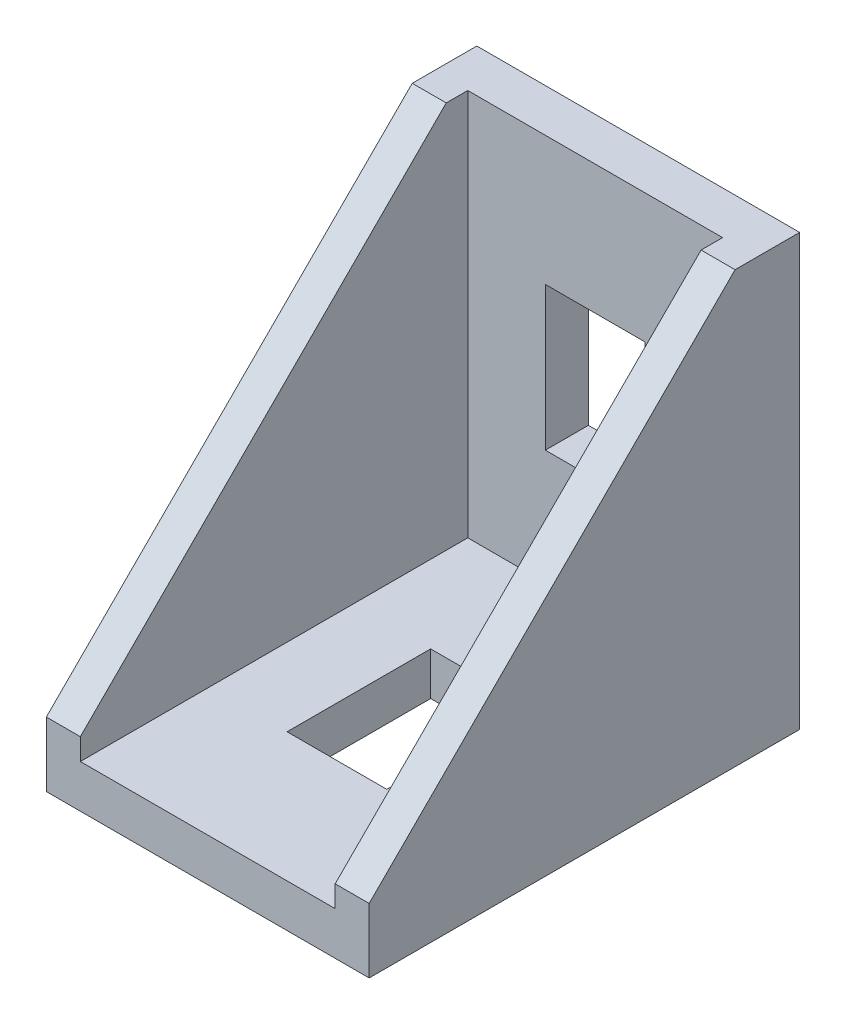
from build123d import *

# Parameters (mm, degrees)
BOSS_EXTRUDE2_DEPTH     = 7.5
CAVITY_START            = 2
SKETCH3_W               = 5.92
SKETCH3_H               = 9.5
CAVITY_DEPTH            = 23.259018941
SLOT_CUT_REACH          = 26.259
SQUARE_START            = -2
SKETCH8_W               = 2.315
SKETCH8_H               = 6.67
SQUARE_SLOT_DEPTH       = 2
BOSS_EXTRUDE3_DEPTH     = 0.8
SKETCH9_W               = 2.86
SKETCH9_H               = 1.08
SQUARE_RAILS_DEPTH      = 1.08
HALF_START              = 5.92
HALF_MIRROR_DEPTH       = 1.58
HALF_MIRROR_2_OUTLINE_W = 6
HALF_MIRROR_2_OUTLINE_H = 2
HALF_MIRROR_2_DEPTH     = 5.92
HALF_START_2            = 2.315
HALF_MIRROR_3_OUTLINE_W = 6.67
HALF_MIRROR_3_OUTLINE_H = 2
HALF_MIRROR_3_DEPTH     = 3.605
HALF_MIRROR_4_OUTLINE_W = 1.08
HALF_MIRROR_4_OUTLINE_H = 1.08
HALF_MIRROR_4_DEPTH     = 2.86
FULL_START              = -7.5
FULL_MIRROR_OUTLINE_W   = 2
FULL_MIRROR_OUTLINE_H   = 6
FULL_MIRROR_DEPTH       = 15
FULL_MIRROR_2_DEPTH     = 1.58
FULL_START_2            = 5.92
FULL_MIRROR_3_DEPTH     = 1.58
FULL_START_3            = -5.92
FULL_MIRROR_4_OUTLINE_W = 2
FULL_MIRROR_4_OUTLINE_H = 6.67
FULL_MIRROR_4_DEPTH     = 3.605
FULL_START_4            = 2.315
FULL_MIRROR_5_OUTLINE_W = 2
FULL_MIRROR_5_OUTLINE_H = 6.67
FULL_MIRROR_5_DEPTH     = 3.605
FULL_START_5            = -2.86
FULL_MIRROR_6_OUTLINE_W = 1.08
FULL_MIRROR_6_OUTLINE_H = 1.08
FULL_MIRROR_6_DEPTH     = 5.72


# Read off the part's stored shape, not the designer's step: Half mirror, Full mirror
with BuildPart() as part:
    # Sketch2 → Boss-Extrude2 (new body)
    with BuildSketch(Plane(origin=(0, 0, 0), x_dir=(0, 0, -1), z_dir=(1, 0, 0))):
        Polygon((-11.5, 11.5), (-3, 20), (0, 20), (0, 0), align=None)
    extrude(amount=-BOSS_EXTRUDE2_DEPTH)

    # Sketch3 → Cavity (cut, through all)
    with BuildSketch(Plane(origin=(0, 0, 0), x_dir=(1, 0, 0), z_dir=(0, 1, 0)).offset(CAVITY_START)):
        with Locations((-2.96, -6.75)):
            Rectangle(SKETCH3_W, SKETCH3_H)
    extrude(amount=CAVITY_DEPTH, mode=Mode.SUBTRACT)

    # Sketch4 → Slot cut (cut, up to next)
    with BuildSketch(Plane.XY, mode=Mode.PRIVATE) as slot_cut_sk1:
        with BuildLine():
            Line((0, 7.33), (-0.015, 7.33))
            ThreePointArc((-0.015, 7.33), (-1.641345597, 8.003654403), (-2.315, 9.63))
            Line((-2.315, 9.63), (-2.315, 11.7))
            ThreePointArc((-2.315, 11.7), (-1.641345597, 13.326345597), (-0.015, 14))
            Line((-0.015, 14), (0, 14))
            Line((0, 14), (0, 7.33))
        make_face()
    slot_cut_tool1 = extrude(slot_cut_sk1.sketch, amount=SLOT_CUT_REACH, mode=Mode.PRIVATE) & part.part
    add(slot_cut_tool1.solids().sort_by_distance((-1.046523, 10.665, 0))[0], mode=Mode.SUBTRACT)

    # Sketch8 → Square slot (cut)
    with BuildSketch(Plane(origin=(0, 0, 0), x_dir=(-1, 0, 0), z_dir=(0, 0, -1)).offset(SQUARE_START)):
        with Locations((1.1575, 10.665)):
            Rectangle(SKETCH8_W, SKETCH8_H)
    extrude(amount=SQUARE_SLOT_DEPTH, mode=Mode.SUBTRACT)

    # Sketch6 → Boss-Extrude3 (add)
    with BuildSketch(Plane(origin=(0, 0, 0), x_dir=(-1, 0, 0), z_dir=(0, 0, -1))):
        with BuildLine():
            Line((0, 3.18), (2.33, 3.18))
            ThreePointArc((2.33, 3.18), (2.704766594, 3.024766594), (2.86, 2.65))
            Line((2.86, 2.65), (2.86, 2.63))
            ThreePointArc((2.86, 2.63), (2.704766594, 2.255233406), (2.33, 2.1))
            Line((2.33, 2.1), (0, 2.1))
            Line((0, 2.1), (0, 3.18))
        make_face()
        with BuildLine():
            Line((0, 17.26), (2.33, 17.26))
            ThreePointArc((2.33, 17.26), (2.704766594, 17.104766594), (2.86, 16.73))
            Line((2.86, 16.73), (2.86, 16.71))
            ThreePointArc((2.86, 16.71), (2.704766594, 16.335233406), (2.33, 16.18))
            Line((2.33, 16.18), (0, 16.18))
            Line((0, 16.18), (0, 17.26))
        make_face()
    extrude(amount=BOSS_EXTRUDE3_DEPTH)

    # Sketch9 → Square rails (add)
    with BuildSketch(Plane(origin=(0, 0, 0), x_dir=(-1, 0, 0), z_dir=(0, 0, -1))):
        with Locations((1.43, 16.72)):
            Rectangle(SKETCH9_W, SKETCH9_H)
        with Locations((1.43, 2.64)):
            Rectangle(SKETCH9_W, SKETCH9_H)
    extrude(amount=SQUARE_RAILS_DEPTH)



with BuildPart() as body_2:
    # Half mirror outline → Half mirror (new body)
    with BuildSketch(Plane.YZ.offset(HALF_START)):
        Polygon((0, 0), (20, 0), (20, 3), (11.5, 11.5), align=None)
    extrude(amount=HALF_MIRROR_DEPTH)


with BuildPart() as part_1:
    add(part.part)

    add(body_2.part)  # Half mirror 2 merges body 2
    # Half mirror 2 outline → Half mirror 2 (add)
    with BuildSketch(Plane.YZ):
        Polygon((2, 2), (0, 0), (7.33, 0), (7.33, 2), align=None)
        with Locations((17, 1)):
            Rectangle(HALF_MIRROR_2_OUTLINE_W, HALF_MIRROR_2_OUTLINE_H)
    extrude(amount=HALF_MIRROR_2_DEPTH)

    # Half mirror 3 outline → Half mirror 3 (add)
    with BuildSketch(Plane.YZ.offset(HALF_START_2)):
        with Locations((10.665, 1)):
            Rectangle(HALF_MIRROR_3_OUTLINE_W, HALF_MIRROR_3_OUTLINE_H)
    extrude(amount=HALF_MIRROR_3_DEPTH)

    # Half mirror 4 outline → Half mirror 4 (add)
    with BuildSketch(Plane.YZ):
        with Locations((2.64, -0.54)):
            Rectangle(HALF_MIRROR_4_OUTLINE_W, HALF_MIRROR_4_OUTLINE_H)
        with Locations((16.72, -0.54)):
            Rectangle(HALF_MIRROR_4_OUTLINE_W, HALF_MIRROR_4_OUTLINE_H)
    extrude(amount=HALF_MIRROR_4_DEPTH)

    # Full mirror outline → Full mirror (add)
    with BuildSketch(Plane.YZ.offset(FULL_START)):
        Polygon((0, 7.33), (0, 0), (2, 2), (2, 7.33), align=None)
        with Locations((1, 17)):
            Rectangle(FULL_MIRROR_OUTLINE_W, FULL_MIRROR_OUTLINE_H)
    extrude(amount=FULL_MIRROR_DEPTH)

    # Full mirror 2 outline → Full mirror 2 (add)
    with BuildSketch(Plane.YZ.offset(FULL_START)):
        Polygon((2, 7.33), (2, 2), (11.5, 11.5), (3, 20), (2, 20), (2, 14), (0, 14), (0, 7.33), align=None)
    extrude(amount=FULL_MIRROR_2_DEPTH)

    # Full mirror 3 outline → Full mirror 3 (add)
    with BuildSketch(Plane.YZ.offset(FULL_START_2)):
        Polygon((2, 7.33), (2, 2), (11.5, 11.5), (3, 20), (2, 20), (2, 14), (0, 14), (0, 7.33), align=None)
    extrude(amount=FULL_MIRROR_3_DEPTH)

    # Full mirror 4 outline → Full mirror 4 (add)
    with BuildSketch(Plane.YZ.offset(FULL_START_3)):
        with Locations((1, 10.665)):
            Rectangle(FULL_MIRROR_4_OUTLINE_W, FULL_MIRROR_4_OUTLINE_H)
    extrude(amount=FULL_MIRROR_4_DEPTH)

    # Full mirror 5 outline → Full mirror 5 (add)
    with BuildSketch(Plane.YZ.offset(FULL_START_4)):
        with Locations((1, 10.665)):
            Rectangle(FULL_MIRROR_5_OUTLINE_W, FULL_MIRROR_5_OUTLINE_H)
    extrude(amount=FULL_MIRROR_5_DEPTH)

    # Full mirror 6 outline → Full mirror 6 (add)
    with BuildSketch(Plane.YZ.offset(FULL_START_5)):
        with Locations((-0.54, 2.64)):
            Rectangle(FULL_MIRROR_6_OUTLINE_W, FULL_MIRROR_6_OUTLINE_H)
        with Locations((-0.54, 16.72)):
            Rectangle(FULL_MIRROR_6_OUTLINE_W, FULL_MIRROR_6_OUTLINE_H)
    extrude(amount=FULL_MIRROR_6_DEPTH)


solid = part_1.part
